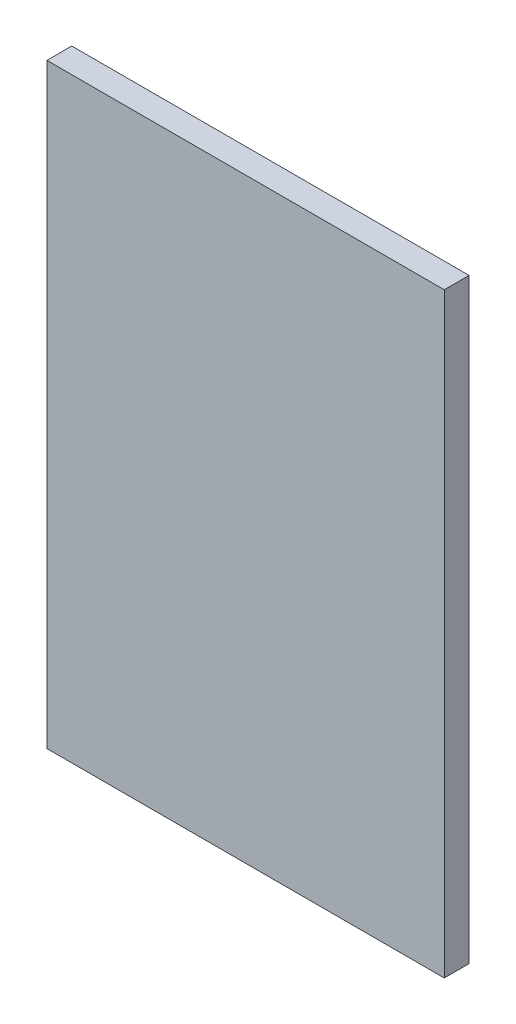
from build123d import *

# Parameters (mm, degrees)
SKETCH1_W           = 101.6
SKETCH1_H           = 152.4
BOSS_EXTRUDE1_DEPTH = 6.35


with BuildPart() as part:
    # Sketch1 → Boss-Extrude1 (new body)
    with BuildSketch(Plane.XY):
        with Locations((50.8, 76.2)):
            Rectangle(SKETCH1_W, SKETCH1_H)
    extrude(amount=BOSS_EXTRUDE1_DEPTH)


solid = part.part
